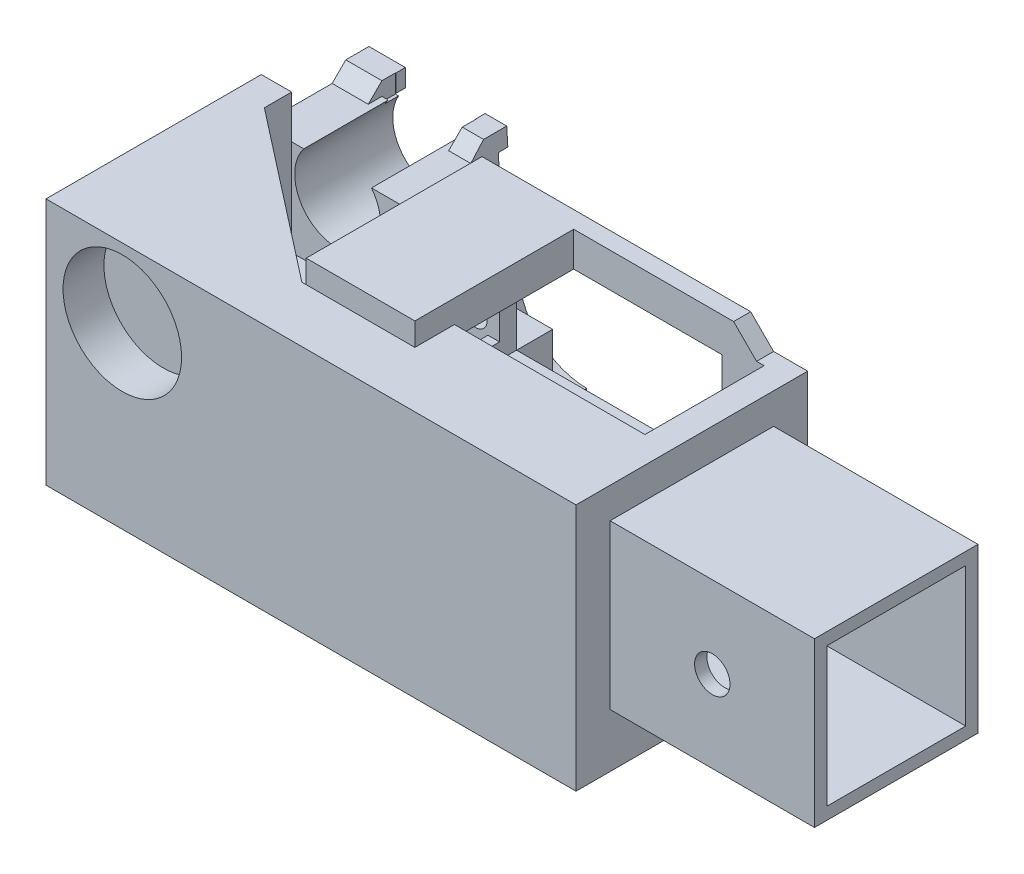
from build123d import *

# Parameters (mm, degrees)
SKETCH1_W                = 54.356
SKETCH1_H                = 34.4678
SKETCH1_W_2              = 40.2082
SKETCH1_H_2              = 20.32
BOSS_EXTRUDE1_DEPTH      = 27.94
SKETCH2_W                = 54.356
SKETCH2_H                = 34.4678
SKETCH2_W_2              = 45.7962
SKETCH2_H_2              = 25.908
CUT_EXTRUDE1_DEPTH       = 24.765
SKETCH3_R                = 2.04968225
SKETCH3_R_2              = 2.0955
CUT_EXTRUDE2_DEPTH       = 43.618007851
SKETCH4_W                = 19.05
SKETCH4_H                = 9.525
CUT_EXTRUDE3_DEPTH       = 12.7
SKETCH5_W                = 45.7962
SKETCH5_H                = 25.908
BOSS_EXTRUDE2_DEPTH      = 2.54
SKETCH6_W                = 25.4
SKETCH6_H                = 4.2799
BOSS_EXTRUDE3_DEPTH      = 27.305
SKETCH7_W                = 25.4
SKETCH7_H                = 6.35
BOSS_EXTRUDE4_DEPTH      = 19.05
SKETCH10_W               = 3.175
SKETCH10_H               = 19.05
BOSS_EXTRUDE5_DEPTH      = 19.05
CHAMFER1_SIZE            = 19.05
SKETCH12_W               = 7.62
SKETCH12_H               = 31.75
BOSS_EXTRUDE6_DEPTH      = 3.175
SKETCH13_W               = 41.4782
SKETCH13_H               = 21.59
CUT_EXTRUDE7_DEPTH       = 27.94
SKETCH14_W               = 22.225
SKETCH14_H               = 20.828
SKETCH14_W_2             = 49.53
SKETCH14_H_2             = 7.4549
CUT_EXTRUDE8_DEPTH       = 61.866925258
SKETCH15_W               = 3.175
SKETCH15_H               = 4.2799
CUT_EXTRUDE9_DEPTH       = 64.49980823
SKETCH16_W               = 45.796723327
SKETCH16_H               = 30.48
BOSS_EXTRUDE7_DEPTH      = 20.32
BOSS_EXTRUDE8_DEPTH      = 15.24
BOSS_EXTRUDE8_DEPTH_BACK = 10.16
SKETCH17_W               = 42.3799
SKETCH17_H               = 20.32
SKETCH18_W               = 28.227007584
SKETCH18_H               = 18.279535796
BOSS_EXTRUDE9_DEPTH      = 17.871186
SKETCH19_R               = 8.001
CUT_EXTRUDE10_DEPTH      = 18.279536
SKETCH20_W               = 19.05
SKETCH20_H               = 21.1201
CUT_EXTRUDE11_DEPTH      = 75.022207933
SKETCH21_W               = 45.796723327
SKETCH21_H               = 46.228
BOSS_EXTRUDE10_DEPTH     = 12.7
SKETCH25_W               = 6.35
SKETCH25_H               = 7.62
SKETCH25_W_2             = 10.629376673
SKETCH25_H_2             = 25.1079
BOSS_EXTRUDE12_DEPTH     = 3.175
SKETCH26_W               = 10.629376673
SKETCH26_H               = 50.5079
BOSS_EXTRUDE14_DEPTH     = 17.78
BOSS_EXTRUDE15_START     = -3.175
SKETCH27_W               = 4.942428742
SKETCH27_H               = 50.5079
BOSS_EXTRUDE15_DEPTH     = 25.4
SKETCH28_W               = 7.846471258
SKETCH28_H               = 22.225
BOSS_EXTRUDE16_DEPTH     = 25.4
SKETCH29_W               = 30.48
SKETCH29_H               = 30.48
BOSS_EXTRUDE17_DEPTH     = 38.1
SKETCH30_W               = 25.908
SKETCH30_H               = 25.908
CUT_EXTRUDE13_DEPTH      = 38.1
SKETCH31_R               = 3.302
CUT_EXTRUDE14_DEPTH      = 88.144583079
BOSS_EXTRUDE18_DEPTH     = 20.32
SKETCH34_W               = 31.3182
SKETCH34_H               = 12.200464204
CUT_EXTRUDE15_DEPTH      = 89.208287701
BOSS_EXTRUDE22_REACH     = 99.704
SKETCH37_R               = 11.049
CUT_EXTRUDE16_DEPTH      = 7.62
BOSS_EXTRUDE25_REACH     = 90.533
SKETCH38_W               = 20.264989175
SKETCH38_H               = 6.4389
SKETCH39_W               = 10.629376673
SKETCH39_H               = 43.18
CUT_EXTRUDE17_DEPTH      = 4.2799
BOSS_EXTRUDE26_DEPTH     = 3.175
SKETCH42_W               = 28.227007584
SKETCH42_H               = 2.54
BOSS_EXTRUDE27_DEPTH     = 2.54
CUT_EXTRUDE18_DEPTH      = 7.62
CUT_EXTRUDE18_DEPTH_BACK = 2.54
SKETCH41_W               = 14.986
SKETCH41_H               = 7.62
SKETCH43_W               = 6.573507584
SKETCH43_H               = 3.302
SKETCH43_W_2             = 6.7945
BOSS_EXTRUDE28_DEPTH     = 1.778
BOSS_EXTRUDE29_DEPTH     = 6.731
BOSS_EXTRUDE30_DEPTH     = 6.510007584
CUT_EXTRUDE19_DEPTH      = 6.35
CUT_EXTRUDE20_DEPTH      = 6.35
CUT_EXTRUDE20_DEPTH_BACK = 6.35


with BuildPart() as part:
    # Sketch1 → Boss-Extrude1 (new body)
    with BuildSketch(Plane.XY):
        Rectangle(SKETCH1_W, SKETCH1_H)
        Rectangle(SKETCH1_W_2, SKETCH1_H_2, mode=Mode.SUBTRACT)
    extrude(amount=-BOSS_EXTRUDE1_DEPTH)

    # Sketch2 → Cut-Extrude1 (cut)
    with BuildSketch(Plane.XY):
        Rectangle(SKETCH2_W, SKETCH2_H)
        Rectangle(SKETCH2_W_2, SKETCH2_H_2, mode=Mode.SUBTRACT)
    extrude(amount=-CUT_EXTRUDE1_DEPTH, mode=Mode.SUBTRACT)

    # Sketch3 → Cut-Extrude2 (cut, through all)
    with BuildSketch(Plane(origin=(0, 0, -27.94), x_dir=(-1, 0, 0), z_dir=(0, 0, -1))):
        with Locations((-25.146, 5.6769)):
            Circle(SKETCH3_R)
        with Locations((-25.146, -5.6769)):
            Circle(SKETCH3_R_2)
        with Locations((25.146, -5.6769)):
            Circle(SKETCH3_R_2)
        with Locations((25.146, 5.6769)):
            Circle(SKETCH3_R_2)
    extrude(amount=-CUT_EXTRUDE2_DEPTH, mode=Mode.SUBTRACT)

    # Sketch4 → Cut-Extrude3 (cut)
    with BuildSketch(Plane(origin=(22.8981, 0, 0), x_dir=(0, 0, -1), z_dir=(1, 0, 0))):
        with Locations((12.065, 0)):
            Rectangle(SKETCH4_W, SKETCH4_H)
    extrude(amount=-CUT_EXTRUDE3_DEPTH, mode=Mode.SUBTRACT)

    # Sketch5 → Boss-Extrude2 (add)
    with BuildSketch(Plane.XY):
        Rectangle(SKETCH5_W, SKETCH5_H)
    extrude(amount=BOSS_EXTRUDE2_DEPTH)

    # Sketch6 → Boss-Extrude3 (add)
    with BuildSketch(Plane.XY.offset(2.54)):
        with Locations((0, -15.09395)):
            Rectangle(SKETCH6_W, SKETCH6_H)
    extrude(amount=-BOSS_EXTRUDE3_DEPTH)

    # Sketch7 → Boss-Extrude4 (add)
    with BuildSketch(Plane.XY.offset(2.54)):
        with Locations((0, -14.0589)):
            Rectangle(SKETCH7_W, SKETCH7_H)
    extrude(amount=BOSS_EXTRUDE4_DEPTH)

    # Sketch10 → Boss-Extrude5 (add)
    with BuildSketch(Plane(origin=(0, -10.8839, 0), x_dir=(1, 0, 0), z_dir=(0, 1, 0))):
        with Locations((11.1125, -12.065)):
            Rectangle(SKETCH10_W, SKETCH10_H)
        with Locations((-11.1125, -12.065)):
            Rectangle(SKETCH10_W, SKETCH10_H)
    extrude(amount=BOSS_EXTRUDE5_DEPTH)

    # Chamfer1
    chamfer1_edges = [part.edges().sort_by_distance(p)[0] for p in [
        (-11.1125, 8.1661, 21.59),
        (11.1125, 8.1661, 21.59),
    ]]
    chamfer(chamfer1_edges, length=CHAMFER1_SIZE - 0.0001)  # a hair under: the kernel refuses the full size

    # Sketch12 → Boss-Extrude6 (add)
    with BuildSketch(Plane.XZ.offset(17.2339)):
        with Locations((0, -12.065)):
            Rectangle(SKETCH12_W, SKETCH12_H)
    extrude(amount=BOSS_EXTRUDE6_DEPTH)

    # Sketch13 → Cut-Extrude7 (cut)
    with BuildSketch(Plane(origin=(0, 0, -27.94), x_dir=(-1, 0, 0), z_dir=(0, 0, -1))):
        Rectangle(SKETCH13_W, SKETCH13_H)
    extrude(amount=-CUT_EXTRUDE7_DEPTH, mode=Mode.SUBTRACT)

    # Sketch14 → Cut-Extrude8 (cut, through all)
    with BuildSketch(Plane.ZY.offset(22.8981)):
        with Locations((-13.6525, 2.54)):
            Rectangle(SKETCH14_W, SKETCH14_H)
        with Locations((-3.175, -16.68145)):
            Rectangle(SKETCH14_W_2, SKETCH14_H_2)
    extrude(amount=-CUT_EXTRUDE8_DEPTH, mode=Mode.SUBTRACT)

    # Sketch15 → Cut-Extrude9 (cut, through all)
    with BuildSketch(Plane.ZY.offset(27.178)):
        with Locations((-26.3525, -15.09395)):
            Rectangle(SKETCH15_W, SKETCH15_H)
    extrude(amount=-CUT_EXTRUDE9_DEPTH, mode=Mode.SUBTRACT)

    # Sketch16 → Boss-Extrude7 (add)
    with BuildSketch(Plane.XZ.offset(12.954)):
        with Locations((0.000261663, -12.7)):
            Rectangle(SKETCH16_W, SKETCH16_H)
    extrude(amount=BOSS_EXTRUDE7_DEPTH)

    # Sketch20 → Cut-Extrude11 (cut, through all)
    with BuildSketch(Plane.ZY.offset(22.8981)):
        with Locations((12.065, -2.39395)):
            Rectangle(SKETCH20_W, SKETCH20_H)
    extrude(amount=-CUT_EXTRUDE11_DEPTH, mode=Mode.SUBTRACT)

    # Sketch21 → Boss-Extrude10 (add)
    with BuildSketch(Plane.XY.offset(2.54)):
        with Locations((0.000261663, -10.16)):
            Rectangle(SKETCH21_W, SKETCH21_H)
    extrude(amount=BOSS_EXTRUDE10_DEPTH)

    # Sketch25 → Boss-Extrude12 (add)
    with BuildSketch(Plane(origin=(0, 0, -27.94), x_dir=(-1, 0, 0), z_dir=(0, 0, -1))):
        with Locations((-30.353, 13.4239)):
            Rectangle(SKETCH25_W, SKETCH25_H)
        with Locations((-28.213311664, -20.72005)):
            Rectangle(SKETCH25_W_2, SKETCH25_H_2)
    extrude(amount=-BOSS_EXTRUDE12_DEPTH)

    # Sketch26 → Boss-Extrude14 (add)
    with BuildSketch(Plane.XY.offset(15.24)):
        with Locations((28.213311664, -8.02005)):
            Rectangle(SKETCH26_W, SKETCH26_H)
    extrude(amount=-BOSS_EXTRUDE14_DEPTH)

    # Sketch27 → Boss-Extrude15 (add)
    with BuildSketch(Plane.XY.offset(-24.765).offset(BOSS_EXTRUDE15_START)):
        with Locations((31.056785629, -8.02005)):
            Rectangle(SKETCH27_W, SKETCH27_H)
    extrude(amount=BOSS_EXTRUDE15_DEPTH)

    # Sketch28 → Boss-Extrude16 (add)
    with BuildSketch(Plane(origin=(0, -7.874, 0), x_dir=(1, 0, 0), z_dir=(0, 1, 0))):
        with Locations((24.662335629, 13.6525)):
            Rectangle(SKETCH28_W, SKETCH28_H)
    extrude(amount=-BOSS_EXTRUDE16_DEPTH)

    # Sketch29 → Boss-Extrude17 (add)
    with BuildSketch(Plane(origin=(33.528, 0, 0), x_dir=(0, 0, -1), z_dir=(1, 0, 0))):
        with Locations((6.35, -8.02005)):
            Rectangle(SKETCH29_W, SKETCH29_H)
    extrude(amount=BOSS_EXTRUDE17_DEPTH)

    # Sketch30 → Cut-Extrude13 (cut)
    with BuildSketch(Plane(origin=(71.628, 0, 0), x_dir=(0, 0, -1), z_dir=(1, 0, 0))):
        with Locations((6.35, -8.02005)):
            Rectangle(SKETCH30_W, SKETCH30_H)
    extrude(amount=-CUT_EXTRUDE13_DEPTH, mode=Mode.SUBTRACT)

    # Sketch31 → Cut-Extrude14 (cut, through all)
    with BuildSketch(Plane(origin=(0, 0, -21.59), x_dir=(-1, 0, 0), z_dir=(0, 0, -1))):
        with Locations(Location((-52.578, -8.02005, 0), (0, 0, 90))):
            Circle(SKETCH31_R)
    extrude(amount=-CUT_EXTRUDE14_DEPTH, mode=Mode.SUBTRACT)



with BuildPart() as body_2:
    # Sketch17 → Boss-Extrude8 (new, two sides: drawn at the far end of the back side and taken through both)
    with BuildSketch(Plane(origin=(0, 0, -27.94), x_dir=(-1, 0, 0), z_dir=(0, 0, -1)).offset(-BOSS_EXTRUDE8_DEPTH_BACK)):
        with Locations((44.08805, -23.114)):
            Rectangle(SKETCH17_W, SKETCH17_H)
    extrude(amount=BOSS_EXTRUDE8_DEPTH + BOSS_EXTRUDE8_DEPTH_BACK)

    # Sketch18 → Boss-Extrude9 (add)
    with BuildSketch(Plane(origin=(0, -12.954, 0), x_dir=(1, 0, 0), z_dir=(0, 1, 0))):
        with Locations((-51.164496208, 34.040232102)):
            Rectangle(SKETCH18_W, SKETCH18_H)
    extrude(amount=BOSS_EXTRUDE9_DEPTH)

    # Sketch19 → Cut-Extrude10 (cut)
    with BuildSketch(Plane(origin=(0, 0, -43.18), x_dir=(-1, 0, 0), z_dir=(0, 0, -1))):
        with Locations((51.054, 0)):
            Circle(SKETCH19_R)
    extrude(amount=-CUT_EXTRUDE10_DEPTH, mode=Mode.SUBTRACT)


with BuildPart() as part_1:
    add(part.part)

    add(body_2.part)  # Boss-Extrude18 merges body 2
    # Sketch33 → Boss-Extrude18 (add)
    with BuildSketch(Plane.XZ.offset(33.274)):
        Polygon((-65.278, -17.78), (-22.8981, 15.24), (-22.8981, -17.78), align=None)
    extrude(amount=-BOSS_EXTRUDE18_DEPTH)

    # Sketch34 → Cut-Extrude15 (cut, through all)
    with BuildSketch(Plane(origin=(0, -10.795, 0), x_dir=(1, 0, 0), z_dir=(0, 1, 0))):
        Polygon((-27.9781, 19.820464204), (-59.63147171, 19.820464204), (-27.9781, -4.842036979), align=None)
        with Locations((0, 13.720232102)):
            Rectangle(SKETCH34_W, SKETCH34_H)
    extrude(amount=-CUT_EXTRUDE15_DEPTH, mode=Mode.SUBTRACT)

    # Boss-Extrude22: up to this face of the body (flat: up to its plane)
    boss_extrude22_end = Plane(part_1.part.faces().sort_by_distance((0.000186903, 12.954, 6.350020732))[0])
    # Sketch36 → Boss-Extrude22 (add, up to the picked face)
    with BuildSketch(Plane.XZ.offset(33.274), mode=Mode.PRIVATE) as boss_extrude22_sk1:
        Polygon((-65.278, -17.78), (-65.278, 15.24), (-22.8981, 15.24), (-22.8981, 8.800083128), (-22.8981, 4.842036979), (-27.9781, 4.842036979), (-59.63147171, -19.820464204), (-59.63147171, -24.900464204), (-65.278, -24.900464204), (-65.278, -19.820464204), align=None)
    boss_extrude22_tool1 = split(extrude(boss_extrude22_sk1.sketch, amount=-BOSS_EXTRUDE22_REACH, mode=Mode.PRIVATE), bisect_by=boss_extrude22_end, keep=Keep.BOTH, mode=Mode.PRIVATE)
    add(boss_extrude22_tool1.solids().sort_by(Axis((-49.126588, -33.274, 1.423085), (0, 1, 0)))[0])

    # Sketch37 → Cut-Extrude16 (cut)
    with BuildSketch(Plane.XY.offset(15.24)):
        with Locations((-51.054, 0)):
            Circle(SKETCH37_R)
    extrude(amount=-CUT_EXTRUDE16_DEPTH, mode=Mode.SUBTRACT)

    # Boss-Extrude25: up to this face of the body (flat: up to its plane)
    boss_extrude25_end = Plane(part_1.part.faces().sort_by_distance((-25.4381, 0, 4.842036979))[0])
    # Sketch38 → Boss-Extrude25 (add, up to the picked face)
    with BuildSketch(Plane.XY.offset(-24.765), mode=Mode.PRIVATE) as boss_extrude25_sk1:
        with Locations((-17.045505412, 14.01445)):
            Rectangle(SKETCH38_W, SKETCH38_H)
    boss_extrude25_tool1 = split(extrude(boss_extrude25_sk1.sketch, amount=BOSS_EXTRUDE25_REACH, mode=Mode.PRIVATE), bisect_by=boss_extrude25_end, keep=Keep.BOTH, mode=Mode.PRIVATE)
    add(boss_extrude25_tool1.solids().sort_by(Axis((-17.045505, 14.01445, -24.765), (0, 0, 1)))[0])

    # Sketch39 → Cut-Extrude17 (cut)
    with BuildSketch(Plane(origin=(0, 17.2339, 0), x_dir=(1, 0, 0), z_dir=(0, 1, 0))):
        with Locations((28.213311664, 6.35)):
            Rectangle(SKETCH39_W, SKETCH39_H)
    extrude(amount=-CUT_EXTRUDE17_DEPTH, mode=Mode.SUBTRACT)

    # Sketch40 → Boss-Extrude26 (add)
    with BuildSketch(Plane(origin=(0, 0, -27.94), x_dir=(-1, 0, 0), z_dir=(0, 0, -1))):
        Polygon((-22.898623327, 12.954), (-22.898623327, 17.2339), (-27.178523327, 12.954), align=None)
    extrude(amount=-BOSS_EXTRUDE26_DEPTH)

    # Sketch42 → Boss-Extrude27 (add)
    with BuildSketch(Plane(origin=(0, 0, -43.18), x_dir=(-1, 0, 0), z_dir=(0, 0, -1))):
        with Locations((51.164496208, 6.187186)):
            Rectangle(SKETCH42_W, SKETCH42_H)
    extrude(amount=-BOSS_EXTRUDE27_DEPTH)

    # Sketch41 → Cut-Extrude18 (cut, two sides: drawn at the far end of the back side and taken through both)
    with BuildSketch(Plane(origin=(0, 0, -43.18), x_dir=(-1, 0, 0), z_dir=(0, 0, -1)).offset(-CUT_EXTRUDE18_DEPTH_BACK)):
        with Locations((51.054, 7.842124998)):
            Rectangle(SKETCH41_W, SKETCH41_H)
    extrude(amount=CUT_EXTRUDE18_DEPTH + CUT_EXTRUDE18_DEPTH_BACK, mode=Mode.SUBTRACT)

    # Sketch43 → Boss-Extrude28 (add)
    with BuildSketch(Plane(origin=(0, 0, -43.18), x_dir=(-1, 0, 0), z_dir=(0, 0, -1))):
        with Locations((40.337746208, 5.806186)):
            Rectangle(SKETCH43_W, SKETCH43_H)
        with Locations((61.88075, 5.806186)):
            Rectangle(SKETCH43_W_2, SKETCH43_H)
    extrude(amount=BOSS_EXTRUDE28_DEPTH)

    # Sketch44 → Boss-Extrude29 (add)
    with BuildSketch(Plane.ZY.offset(65.278)):
        Polygon((-40.64, 7.457186), (-40.64, 4.917186), (-38.1, 4.917186), align=None)
    extrude(amount=-BOSS_EXTRUDE29_DEPTH)

    # Sketch45 → Boss-Extrude30 (add)
    with BuildSketch(Plane(origin=(-37.050992416, 0, 0), x_dir=(0, 0, -1), z_dir=(1, 0, 0))):
        Polygon((40.64, 4.917186), (40.64, 7.457186), (38.1, 4.917186), align=None)
    extrude(amount=-BOSS_EXTRUDE30_DEPTH)

    # Sketch46 → Cut-Extrude19 (cut)
    with BuildSketch(Plane(origin=(0, 0, -43.18), x_dir=(-1, 0, 0), z_dir=(0, 0, -1))):
        with BuildLine():
            Line((22.8981, -12.954), (35.5981, -12.954))
            ThreePointArc((35.5981, -12.954), (31.878356121, -21.934256121), (22.8981, -25.654))
            Line((22.8981, -25.654), (22.8981, -12.954))
        make_face()
    extrude(amount=-CUT_EXTRUDE19_DEPTH, mode=Mode.SUBTRACT)

    # Sketch47 → Cut-Extrude20 (cut, two sides: drawn at the far end of the back side and taken through both)
    with BuildSketch(Plane(origin=(0, 0, -43.18), x_dir=(-1, 0, 0), z_dir=(0, 0, -1)).offset(-CUT_EXTRUDE20_DEPTH_BACK)):
        Polygon((37.050992416, 7.457186), (39.590992416, 7.457186), (38.320992416, -12.954), (37.050992416, -12.954), align=None)
    extrude(amount=CUT_EXTRUDE20_DEPTH + CUT_EXTRUDE20_DEPTH_BACK, mode=Mode.SUBTRACT)


solid = part_1.part
